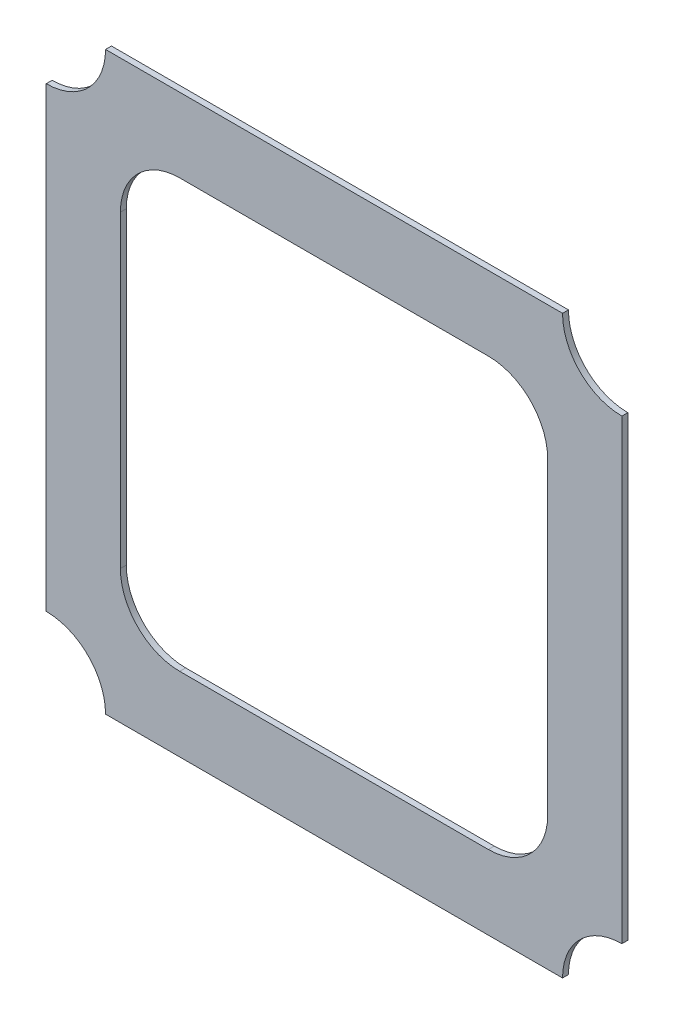
from build123d import *

# Parameters (mm, degrees)
SKETCH1_W           = 97
SKETCH1_H           = 97
SKETCH1_W_2         = 72
SKETCH1_H_2         = 72
BOSS_EXTRUDE1_DEPTH = 1
SKETCH2_W           = 10
SKETCH2_H           = 10
CUT_EXTRUDE1_DEPTH  = 69.596647148
FILLET1_R           = 10


with BuildPart() as part:
    # Sketch1 → Boss-Extrude1 (new body)
    with BuildSketch(Plane.XY):
        Rectangle(SKETCH1_W, SKETCH1_H)
        Rectangle(SKETCH1_W_2, SKETCH1_H_2, mode=Mode.SUBTRACT)
    extrude(amount=BOSS_EXTRUDE1_DEPTH)

    # Sketch2 → Cut-Extrude1 (cut, through all)
    with BuildSketch(Plane.XY.offset(1)):
        with Locations((-43.5, 43.5)):
            Rectangle(SKETCH2_W, SKETCH2_H)
        with Locations((43.5, 43.5)):
            Rectangle(SKETCH2_W, SKETCH2_H)
        with Locations((43.5, -43.5)):
            Rectangle(SKETCH2_W, SKETCH2_H)
        with Locations((-43.5, -43.5)):
            Rectangle(SKETCH2_W, SKETCH2_H)
    extrude(amount=-CUT_EXTRUDE1_DEPTH, mode=Mode.SUBTRACT)

    # Fillet1
    fillet1_edges = [part.edges().sort_by_distance(p)[0] for p in [
        (-36, -36, 0.5),
        (-38.5, -38.5, 0.5),
        (38.5, -38.5, 0.5),
        (36, -36, 0.5),
        (38.5, 38.5, 0.5),
        (36, 36, 0.5),
        (-38.5, 38.5, 0.5),
        (-36, 36, 0.5),
    ]]
    fillet(fillet1_edges, radius=FILLET1_R - 0.0001)  # a hair under: the kernel refuses the full size


solid = part.part
